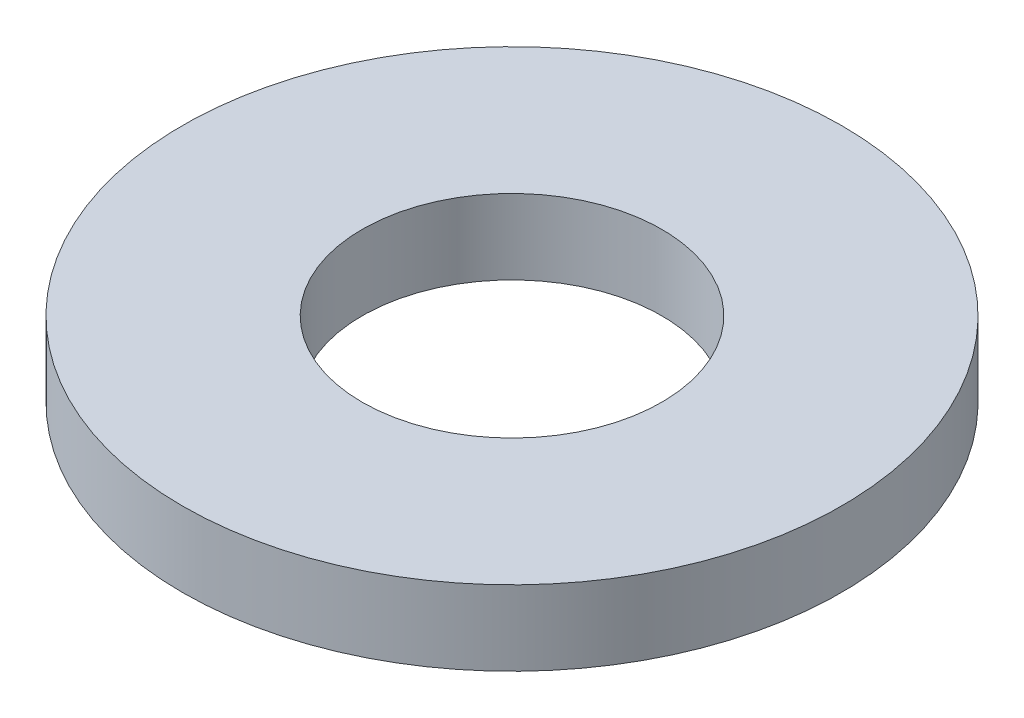
from build123d import *

# Parameters (mm, degrees)
SKETCH_1_R      = 22
SKETCH_1_R_2    = 10
EXTRUDE_1_DEPTH = 5


with BuildPart() as part:
    # Эскиз1 → Вытянуть1 (new body)
    with BuildSketch(Plane(origin=(0, 0, 0), x_dir=(1, 0, 0), z_dir=(0, 1, 0))):
        Circle(SKETCH_1_R)
        Circle(SKETCH_1_R_2, mode=Mode.SUBTRACT)
    extrude(amount=EXTRUDE_1_DEPTH)


solid = part.part
